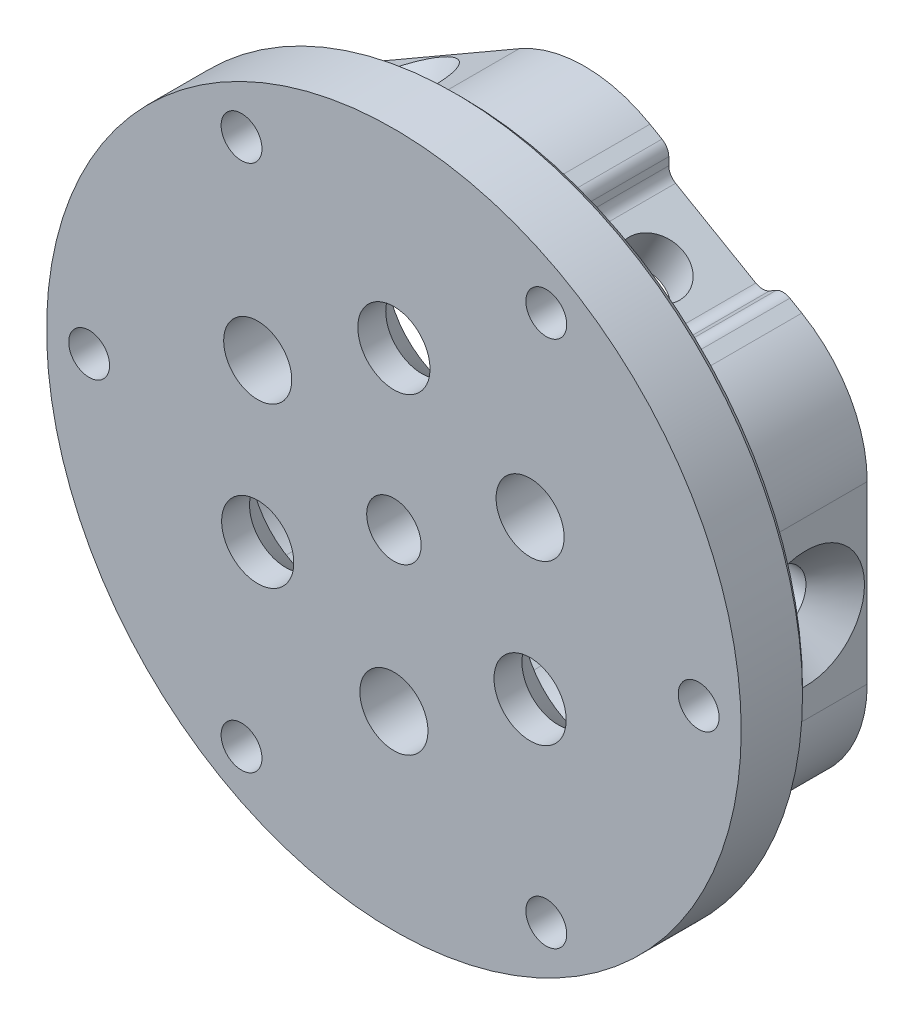
from build123d import *

# Parameters (mm, degrees)
EXTRUDE_1_DEPTH               = 12
SKETCH_3_R                    = 2
CUT_EXTRUDE_1_DEPTH           = 53.426697831
SKETCH_4_R                    = 2
CUT_EXTRUDE_2_DEPTH           = 53.426697831
CUT_EXTRUDE_3_DEPTH           = 49.696731149
CUT_EXTRUDE_3_DEPTH_BACK      = 49.696731149
SKETCH_5_R                    = 2
EXTRUDE_4_DEPTH               = 2
EXTRUDE_4_DEPTH_BACK          = 3
SKETCH_2_R                    = 25.5
SKETCH_2_R_2                  = 1.5
CUT_EXTRUDE_5_REACH           = 40.685
SKETCH_14_R                   = 2.5
CUT_EXTRUDE_6_DEPTH           = 38.16853508
HOLE_WIZARD_4_AT_2_COUNT      = 2
HOLE_WIZARD_4_AT_2_PITCH      = 20
HOLE_WIZARD_4_AT_3_COUNT      = 2
HOLE_WIZARD_4_AT_3_PITCH      = 20
CHAMFER_1_SIZE                = 0.5
SKETCH_17_R                   = 2
CUT_EXTRUDE_7_DEPTH           = 38.16853508
HOLE_START                    = -19.25
HOLE_WIZARD_4_2_OUTLINE_R     = 2.15
HOLE_WIZARD_4_2_OUTLINE_R_2   = 2
HOLE_WIZARD_4_2_DEPTH         = 3.25
HOLE_START_2                  = 16
HOLE_WIZARD_4_2_2_OUTLINE_R   = 2.15
HOLE_WIZARD_4_2_2_OUTLINE_R_2 = 2
HOLE_WIZARD_4_2_2_DEPTH       = 3.25
HOLE_WIZARD_4_2_3_OUTLINE_R   = 2.15
HOLE_WIZARD_4_2_3_OUTLINE_R_2 = 2
HOLE_WIZARD_4_2_3_DEPTH       = 3.25


# Read off the part's stored shape, not the designer's step: 打孔尺寸(%根据十字)槽沉头木螺钉的类型4
with BuildPart() as part:
    # 草图1 → 凸台-拉伸1 (new body)
    with BuildSketch(Plane.XY):
        with BuildLine():
            Line((20.75, -6.437455501), (20.75, 6.437455501))
            ThreePointArc((20.75, 6.437455501), (19.463843876, 11.237455501), (15.95, 14.751299378))
            Line((15.95, 14.751299378), (4.8, 21.188754879))
            ThreePointArc((4.8, 21.188754879), (0, 22.474911003), (-4.8, 21.188754879))
            Line((-4.8, 21.188754879), (-15.95, 14.751299378))
            ThreePointArc((-15.95, 14.751299378), (-19.463843876, 11.237455501), (-20.75, 6.437455501))
            Line((-20.75, 6.437455501), (-20.75, -6.437455501))
            ThreePointArc((-20.75, -6.437455501), (-19.463843876, -11.237455501), (-15.95, -14.751299378))
            Line((-15.95, -14.751299378), (-4.8, -21.188754879))
            ThreePointArc((-4.8, -21.188754879), (0, -22.474911003), (4.8, -21.188754879))
            Line((4.8, -21.188754879), (15.95, -14.751299378))
            ThreePointArc((15.95, -14.751299378), (19.463843876, -11.237455501), (20.75, -6.437455501))
        make_face()
        with BuildLine():
            Line((-16, 6.0044428), (-16, -6.0044428))
            ThreePointArc((-16, -6.0044428), (-15.249742261, -8.8044428), (-13.2, -10.854185061))
            Line((-13.2, -10.854185061), (-2.8, -16.85862786))
            ThreePointArc((-2.8, -16.85862786), (0, -17.608885599), (2.8, -16.85862786))
            Line((2.8, -16.85862786), (13.2, -10.854185061))
            ThreePointArc((13.2, -10.854185061), (15.249742261, -8.8044428), (16, -6.0044428))
            Line((16, -6.0044428), (16, 6.0044428))
            ThreePointArc((16, 6.0044428), (15.249742261, 8.8044428), (13.2, 10.854185061))
            Line((13.2, 10.854185061), (2.8, 16.85862786))
            ThreePointArc((2.8, 16.85862786), (0, 17.608885599), (-2.8, 16.85862786))
            Line((-2.8, 16.85862786), (-13.2, 10.854185061))
            ThreePointArc((-13.2, 10.854185061), (-15.249742261, 8.8044428), (-16, 6.0044428))
        make_face(mode=Mode.SUBTRACT)
    extrude(amount=-EXTRUDE_1_DEPTH)

    # 草图3 → 切除-拉伸1 (cut, through all)
    with BuildSketch(Plane(origin=(10.375, 17.970027129, 0), x_dir=(0.8660254037844384, -0.5000000000000004, 0), z_dir=(0.5000000000000004, 0.8660254037844384, 0))):
        with Locations(Location((0, 7.5, 0), (0, 0, 180))):
            Circle(SKETCH_3_R)
    extrude(amount=-CUT_EXTRUDE_1_DEPTH, mode=Mode.SUBTRACT)

    # 草图4 → 切除-拉伸2 (cut, through all)
    with BuildSketch(Plane(origin=(-10.375, 17.970027129, 0), x_dir=(0.8660254037844387, 0.4999999999999999, 0), z_dir=(-0.49999999999999994, 0.8660254037844388, 0))):
        with Locations(Location((0, 7.5, 0), (0, 0, 180))):
            Circle(SKETCH_4_R)
    extrude(amount=-CUT_EXTRUDE_2_DEPTH, mode=Mode.SUBTRACT)

    # 草图5 → 切除-拉伸3 (cut, two sides: drawn at the far end of the back side and taken through both)
    with BuildSketch(Plane.ZY.offset(20.75).offset(-CUT_EXTRUDE_3_DEPTH_BACK)):
        with Locations(Location((-7.5, 0, 0), (0, 0, 270))):
            Circle(SKETCH_5_R)
    extrude(amount=CUT_EXTRUDE_3_DEPTH + CUT_EXTRUDE_3_DEPTH_BACK, mode=Mode.SUBTRACT)

    # 草图2 → 凸台-拉伸4 (add, two sides: drawn at the far end of the back side and taken through both)
    with BuildSketch(Plane.XY.offset(-EXTRUDE_4_DEPTH_BACK)):
        Circle(SKETCH_2_R)
        with Locations((-11.1875, 19.37731841)):
            Circle(SKETCH_2_R_2, mode=Mode.SUBTRACT)
        with Locations((11.1875, 19.37731841)):
            Circle(SKETCH_2_R_2, mode=Mode.SUBTRACT)
        with Locations((22.375, 0)):
            Circle(SKETCH_2_R_2, mode=Mode.SUBTRACT)
        with Locations((11.1875, -19.37731841)):
            Circle(SKETCH_2_R_2, mode=Mode.SUBTRACT)
        with Locations((-11.1875, -19.37731841)):
            Circle(SKETCH_2_R_2, mode=Mode.SUBTRACT)
        with Locations((-22.375, 0)):
            Circle(SKETCH_2_R_2, mode=Mode.SUBTRACT)
    extrude(amount=EXTRUDE_4_DEPTH + EXTRUDE_4_DEPTH_BACK)

    # 切除-拉伸5: up to this face of the body (flat: up to its plane)
    cut_extrude_5_end = Plane(part.part.faces().sort_by_distance((0, 0, -3))[0])
    # 草图13 → 切除-拉伸5 (cut, up to the picked face)
    with BuildSketch(Plane(origin=(0, 0, -12), x_dir=(-1, 0, 0), z_dir=(0, 0, -1)), mode=Mode.PRIVATE) as cut_extrude_5_sk1:
        with BuildLine():
            Line((21.415437246, -6.437455501), (20.75, -6.437455501))
            Line((20.75, -6.437455501), (20.75, -5.420725942))
            ThreePointArc((20.75, -5.420725942), (20.616025404, -4.920725942), (20.25, -4.554700538))
            Line((20.25, -4.554700538), (19.75, -4.266025404))
            ThreePointArc((19.75, -4.266025404), (19.383974596, -3.9), (19.25, -3.4))
            Line((19.25, -3.4), (19.25, 3.4))
            ThreePointArc((19.25, 3.4), (19.383974596, 3.9), (19.75, 4.266025404))
            Line((19.75, 4.266025404), (20.25, 4.554700538))
            ThreePointArc((20.25, 4.554700538), (20.616025404, 4.920725942), (20.75, 5.420725942))
            Line((20.75, 5.420725942), (20.75, 6.437455501))
            Line((20.75, 6.437455501), (21.415437246, 6.437455501))
            Line((21.415437246, 6.437455501), (21.415437246, -6.437455501))
        make_face()
    cut_extrude_5_tool1 = split(extrude(cut_extrude_5_sk1.sketch, amount=-CUT_EXTRUDE_5_REACH, mode=Mode.PRIVATE), bisect_by=cut_extrude_5_end, keep=Keep.BOTH, mode=Mode.PRIVATE)
    # 草图13 → 切除-拉伸5 (cut, up to the picked face)
    with BuildSketch(Plane(origin=(0, 0, -12), x_dir=(-1, 0, 0), z_dir=(0, 0, -1)), mode=Mode.PRIVATE) as cut_extrude_5_sk2:
        with BuildLine():
            Line((-16.282718623, -15.327584937), (-15.95, -14.751299378))
            Line((-15.95, -14.751299378), (-15.069486373, -15.259664157))
            ThreePointArc((-15.069486373, -15.259664157), (-14.569486373, -15.393638754), (-14.069486373, -15.259664157))
            Line((-14.069486373, -15.259664157), (-13.569486373, -14.970989023))
            ThreePointArc((-13.569486373, -14.970989023), (-13.069486373, -14.837014427), (-12.569486373, -14.970989023))
            Line((-12.569486373, -14.970989023), (-6.680513627, -18.370989023))
            ThreePointArc((-6.680513627, -18.370989023), (-6.314488223, -18.737014427), (-6.180513627, -19.237014427))
            Line((-6.180513627, -19.237014427), (-6.180513627, -19.814364696))
            ThreePointArc((-6.180513627, -19.814364696), (-6.046539031, -20.314364696), (-5.680513627, -20.6803901))
            Line((-5.680513627, -20.6803901), (-4.8, -21.188754879))
            Line((-4.8, -21.188754879), (-5.132718623, -21.765040439))
            Line((-5.132718623, -21.765040439), (-16.282718623, -15.327584937))
        make_face()
    cut_extrude_5_tool2 = split(extrude(cut_extrude_5_sk2.sketch, amount=-CUT_EXTRUDE_5_REACH, mode=Mode.PRIVATE), bisect_by=cut_extrude_5_end, keep=Keep.BOTH, mode=Mode.PRIVATE)
    # 草图13 → 切除-拉伸5 (cut, up to the picked face)
    with BuildSketch(Plane(origin=(0, 0, -12), x_dir=(-1, 0, 0), z_dir=(0, 0, -1)), mode=Mode.PRIVATE) as cut_extrude_5_sk3:
        with BuildLine():
            Line((-5.132718623, 21.765040439), (-4.8, 21.188754879))
            Line((-4.8, 21.188754879), (-5.680513627, 20.6803901))
            ThreePointArc((-5.680513627, 20.6803901), (-6.046539031, 20.314364696), (-6.180513627, 19.814364696))
            Line((-6.180513627, 19.814364696), (-6.180513627, 19.237014427))
            ThreePointArc((-6.180513627, 19.237014427), (-6.314488223, 18.737014427), (-6.680513627, 18.370989023))
            Line((-6.680513627, 18.370989023), (-12.569486373, 14.970989023))
            ThreePointArc((-12.569486373, 14.970989023), (-13.069486373, 14.837014427), (-13.569486373, 14.970989023))
            Line((-13.569486373, 14.970989023), (-14.069486373, 15.259664157))
            ThreePointArc((-14.069486373, 15.259664157), (-14.569486373, 15.393638754), (-15.069486373, 15.259664157))
            Line((-15.069486373, 15.259664157), (-15.95, 14.751299378))
            Line((-15.95, 14.751299378), (-16.282718623, 15.327584937))
            Line((-16.282718623, 15.327584937), (-5.132718623, 21.765040439))
        make_face()
    cut_extrude_5_tool3 = split(extrude(cut_extrude_5_sk3.sketch, amount=-CUT_EXTRUDE_5_REACH, mode=Mode.PRIVATE), bisect_by=cut_extrude_5_end, keep=Keep.BOTH, mode=Mode.PRIVATE)
    add(cut_extrude_5_tool1.solids().sort_by(Axis((-20.4468, 0, -12), (0, 0, 1)))[0], mode=Mode.SUBTRACT)
    add(cut_extrude_5_tool2.solids().sort_by(Axis((10.2234, -17.707448, -12), (0, 0, 1)))[0], mode=Mode.SUBTRACT)
    add(cut_extrude_5_tool3.solids().sort_by(Axis((10.2234, 17.707448, -12), (0, 0, 1)))[0], mode=Mode.SUBTRACT)

    # 草图14 → 切除-拉伸6 (cut, through all)
    with BuildSketch(Plane(origin=(0, 0, -3), x_dir=(-1, 0, 0), z_dir=(0, 0, -1))):
        with Locations((-10, 5.773502692)):
            Circle(SKETCH_14_R)
        with Locations((10, 5.773502692)):
            Circle(SKETCH_14_R)
        with Locations((0, -11.547005384)):
            Circle(SKETCH_14_R)
        with Locations((-10, -5.773502692)):
            Circle(SKETCH_14_R)
        with Locations((0, 11.547005384)):
            Circle(SKETCH_14_R)
        with Locations((10, -5.773502692)):
            Circle(SKETCH_14_R)
    extrude(amount=-CUT_EXTRUDE_6_DEPTH, mode=Mode.SUBTRACT)

    # 草图16 → Hole Wizard 4 (revolve, cut)
    with BuildSketch(Plane(origin=(0, 11.547005384, -3), x_dir=(0, 1, 0), z_dir=(1, 0, 0))):
        Polygon((0, 0), (0, 5), (2.65, 5), (2.65, 2.95), (5.6, 0), align=None)
    hole_wizard_4 = revolve(axis=Axis((0, 11.547005384, -9.35), (0, 0, 1)), mode=Mode.SUBTRACT)

    # Hole Wizard 4 at 2: Hole Wizard 4 ×2
    with Locations(*[Vector(0.5000000000000001, -0.8660254037844387, 0) * (i * HOLE_WIZARD_4_AT_2_PITCH) for i in range(1, HOLE_WIZARD_4_AT_2_COUNT)]):
        add(hole_wizard_4, mode=Mode.SUBTRACT)

    # Hole Wizard 4 at 3: Hole Wizard 4 ×2
    with Locations(*[Vector(-0.49999999999999967, -0.8660254037844389, 0) * (i * HOLE_WIZARD_4_AT_3_PITCH) for i in range(1, HOLE_WIZARD_4_AT_3_COUNT)]):
        add(hole_wizard_4, mode=Mode.SUBTRACT)

    # 倒角1
    chamfer_1_edges = [part.edges().sort_by_distance(p)[0] for p in [
        (-25.5, 0, -3),
    ]]
    chamfer(chamfer_1_edges, length=CHAMFER_1_SIZE)

    # 草图17 → 切除-拉伸7 (cut, through all)
    with BuildSketch(Plane(origin=(0, 0, -3), x_dir=(-1, 0, 0), z_dir=(0, 0, -1))):
        Circle(SKETCH_17_R)
    extrude(amount=-CUT_EXTRUDE_7_DEPTH, mode=Mode.SUBTRACT)

    # Hole Wizard 4 2 outline → Hole Wizard 4 2 (cut)
    with BuildSketch(Plane.YZ.offset(HOLE_START)):
        with Locations((0, -7.5)):
            Circle(HOLE_WIZARD_4_2_OUTLINE_R)
        with Locations((0, -7.5)):
            Circle(HOLE_WIZARD_4_2_OUTLINE_R_2, mode=Mode.SUBTRACT)
    extrude(amount=HOLE_WIZARD_4_2_DEPTH, mode=Mode.SUBTRACT)

    # Hole Wizard 4 2 2 outline → Hole Wizard 4 2 2 (cut)
    with BuildSketch(Plane(origin=(0, 0, 0), x_dir=(0.8660254037844384, -0.5000000000000003, 0), z_dir=(0.5000000000000003, 0.8660254037844385, 0)).offset(HOLE_START_2)):
        with Locations((0, 7.5)):
            Circle(HOLE_WIZARD_4_2_2_OUTLINE_R)
        with Locations((0, 7.5)):
            Circle(HOLE_WIZARD_4_2_2_OUTLINE_R_2, mode=Mode.SUBTRACT)
    extrude(amount=HOLE_WIZARD_4_2_2_DEPTH, mode=Mode.SUBTRACT)

    # Hole Wizard 4 2 3 outline → Hole Wizard 4 2 3 (cut)
    with BuildSketch(Plane(origin=(0, 0, 0), x_dir=(0.8660254037844386, 0.4999999999999999, 0), z_dir=(0.4999999999999999, -0.8660254037844388, 0)).offset(HOLE_START_2)):
        with Locations((0, -7.5)):
            Circle(HOLE_WIZARD_4_2_3_OUTLINE_R)
        with Locations((0, -7.5)):
            Circle(HOLE_WIZARD_4_2_3_OUTLINE_R_2, mode=Mode.SUBTRACT)
    extrude(amount=HOLE_WIZARD_4_2_3_DEPTH, mode=Mode.SUBTRACT)

    # Hole Wizard 4 2 4 outline → Hole Wizard 4 2 4 (revolve, cut)
    with BuildSketch(Plane.YX.offset(7.5)):
        Polygon((2, 16), (2.15, 16), (2.15, 18.6), (4.3, 20.75), (2, 20.75), align=None)
    revolve(axis=Axis((0, 0, -7.5), (1, 0, 0)), mode=Mode.SUBTRACT)

    # Hole Wizard 4 2 5 outline → Hole Wizard 4 2 5 (revolve, cut)
    with BuildSketch(Plane(origin=(0, 0, -7.5), x_dir=(0.8660254037844384, -0.5000000000000003, 0), z_dir=(0, 0, 1))):
        Polygon((2, -20.75), (4.3, -20.75), (2.15, -18.6), (2.15, -16), (2, -16), align=None)
    revolve(axis=Axis((0, 0, -7.5), (0.5000000000000003, 0.8660254037844384, 0)), mode=Mode.SUBTRACT)

    # Hole Wizard 4 2 6 outline → Hole Wizard 4 2 6 (revolve, cut)
    with BuildSketch(Plane(origin=(0, 0, -7.5), x_dir=(0.8660254037844386, 0.4999999999999999, 0), z_dir=(0, 0, -1))):
        Polygon((2.15, -18.6), (2.15, -16), (2, -16), (2, -20.75), (4.3, -20.75), align=None)
    revolve(axis=Axis((0, 0, -7.5), (0.4999999999999999, -0.8660254037844386, 0)), mode=Mode.SUBTRACT)


solid = part.part
